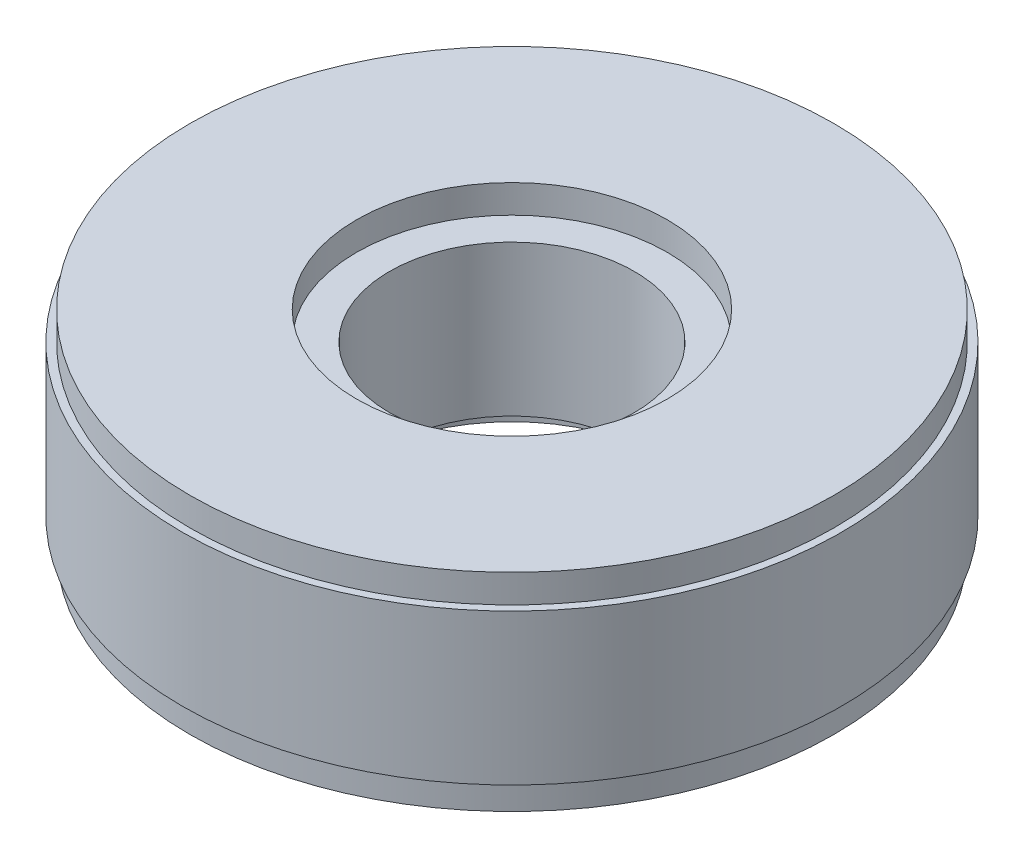
from build123d import *

# Parameters (mm, degrees)
SKETCH1_R           = 17.5
SKETCH1_R_2         = 6.5
BOSS_EXTRUDE1_DEPTH = 4
SKETCH2_R           = 17.1
SKETCH2_R_2         = 8.25
BOSS_EXTRUDE2_DEPTH = 1.5


with BuildPart() as part:
    # Sketch1 → Boss-Extrude1 (new, symmetric)
    with BuildSketch(Plane(origin=(0, 0, 0), x_dir=(1, 0, 0), z_dir=(0, 1, 0))):
        Circle(SKETCH1_R)
        Circle(SKETCH1_R_2, mode=Mode.SUBTRACT)
    extrude(amount=BOSS_EXTRUDE1_DEPTH, both=True)

    # Sketch2 → Boss-Extrude2 (add)
    with BuildSketch(Plane(origin=(0, 4, 0), x_dir=(1, 0, 0), z_dir=(0, 1, 0))):
        Circle(SKETCH2_R)
        Circle(SKETCH2_R_2, mode=Mode.SUBTRACT)
    boss_extrude2 = extrude(amount=BOSS_EXTRUDE2_DEPTH)

    # Mirror1: Boss-Extrude2 across plane
    add(boss_extrude2.mirror(Plane.ZX))


solid = part.part
